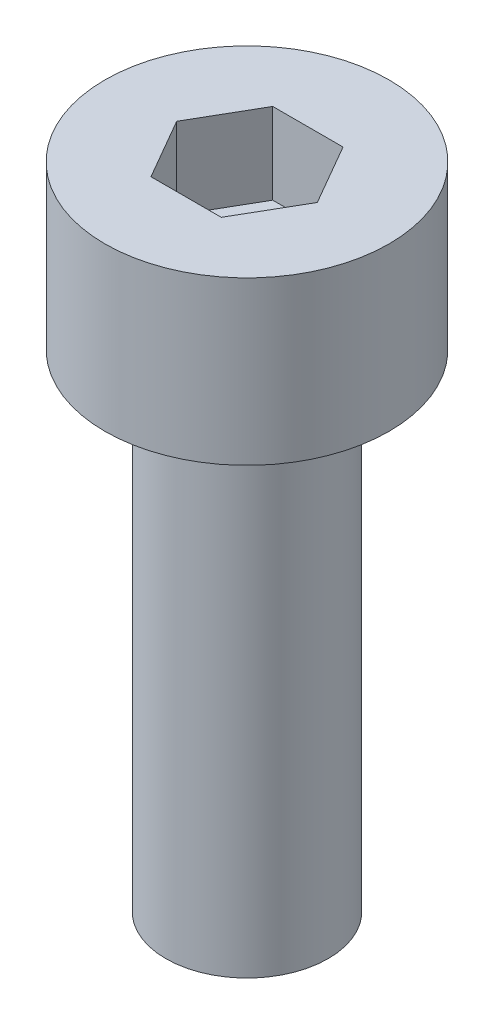
from build123d import *

# Parameters (mm, degrees)
SKETCH_1_R          = 3.5
EXTRUDE_399_DEPTH   = 4
SKETCH_1_3_R        = 2
EXTRUDE_433_DEPTH   = 12
CUT_EXTRUDE_1_DEPTH = 2


with BuildPart() as part:
    # 草图1 → Extrude 399 (new body)
    with BuildSketch(Plane(origin=(0, 0, 0), x_dir=(1, 0, 0), z_dir=(0, 1, 0))):
        Circle(SKETCH_1_R)
    extrude(amount=EXTRUDE_399_DEPTH)

    # 草图1<3> → Extrude 433 (add)
    with BuildSketch(Plane(origin=(0, 0, 0), x_dir=(1, 0, 0), z_dir=(0, 1, 0))):
        Circle(SKETCH_1_3_R)
    extrude(amount=-EXTRUDE_433_DEPTH)

    # 草图2 → 切除-拉伸1 (cut)
    with BuildSketch(Plane(origin=(0, 4, 0), x_dir=(1, 0, 0), z_dir=(0, 1, 0))):
        Polygon((1.732050808, 0), (0.866025404, 1.5), (-0.866025404, 1.5), (-1.732050808, 0), (-0.866025404, -1.5), (0.866025404, -1.5), align=None)
    extrude(amount=-CUT_EXTRUDE_1_DEPTH, mode=Mode.SUBTRACT)


solid = part.part
